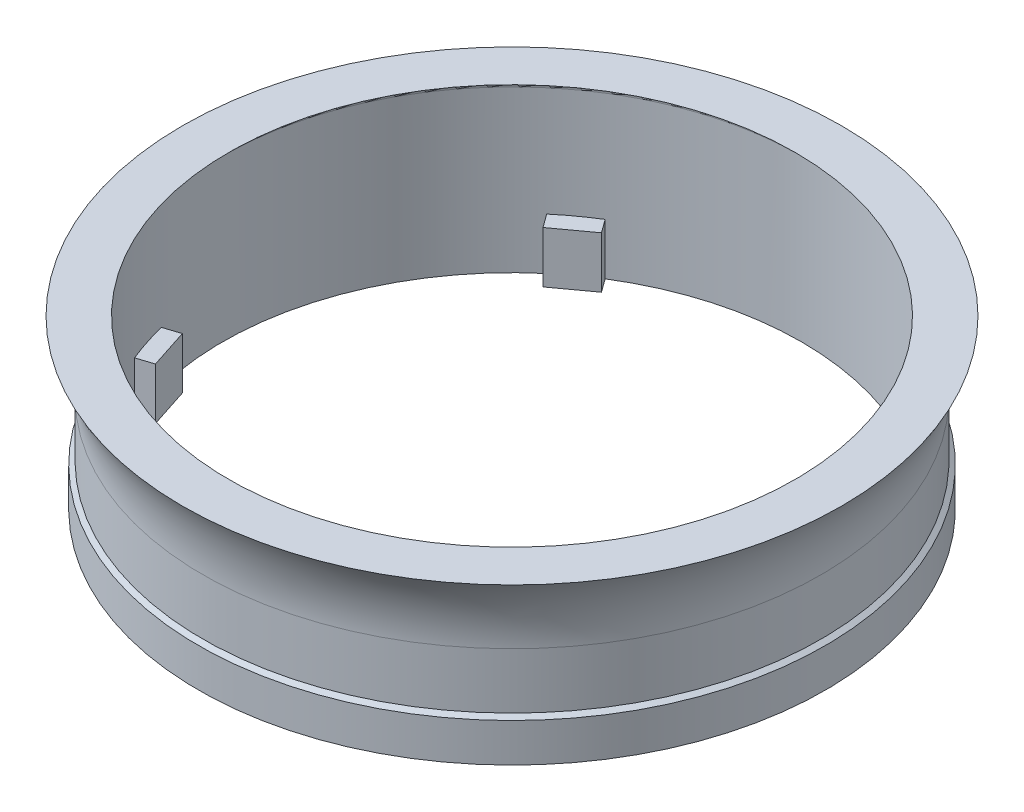
from build123d import *

# Parameters (mm, degrees)
CUT_EXTRUDE3_DEPTH           = 60
CUT_EXTRUDE5_DEPTH           = 2
CUT_EXTRUDE5_DEPTH_BACK      = 30
SKETCH9_R                    = 38
SKETCH9_R_2                  = 23
SKETCH19_W                   = 12
SKETCH19_H                   = 36.5
CUT_REVOLVE2_ANGLE           = 65
CUT_REVOLVE2_OTHER_WAY_ANGLE = 65
SKETCH21_W                   = 3.25
SKETCH21_H                   = 4
BOSS_EXTRUDE3_DEPTH          = 1.35
CIRPATTERN1_COUNT            = 5
CUT_EXTRUDE9_START           = -5
CUT_EXTRUDE9_DEPTH           = 5
SKETCH23_R                   = 10.5
CUT_EXTRUDE10_DEPTH          = 10
SKETCH24_W                   = 15
SKETCH24_H                   = 8
BOSS_EXTRUDE4_DEPTH          = 8
SKETCH26_W                   = 10
SKETCH26_H                   = 6
CUT_EXTRUDE11_DEPTH          = 10
SKETCH27_W                   = 4
SKETCH27_H                   = 5
CUT_EXTRUDE12_DEPTH          = 5
CUT_EXTRUDE14_DEPTH          = 2
CUT_EXTRUDE14_DEPTH_BACK     = 30
SKETCH29_R                   = 1
CUT_EXTRUDE15_DEPTH          = 15
FILLET1_R                    = 6
FILLET2_R                    = 8
INTERSECT2_START             = 13
INTERSECT2_DEPTH             = 50.427876097


# Read off the part's stored shape, not the designer's step: Cut-Extrude9, Intersect2
with BuildPart() as part:
    # Sketch1 → Revolve1 (revolve)
    with BuildSketch(Plane.XY, mode=Mode.PRIVATE) as revolve1_sk:
        with BuildLine():
            Line((0, 63.427876097), (32, 63.427876097))
            ThreePointArc((32, 63.427876097), (37.656854249, 61.084730346), (40, 55.427876097))
            Line((40, 55.427876097), (40, 28.846818009))
            ThreePointArc((40, 28.846818009), (38.792081772, 24.082439968), (35.460140376, 20.469057744))
            Line((35.460140376, 20.469057744), (28.539859624, 15.958818353))
            ThreePointArc((28.539859624, 15.958818353), (25.207918228, 12.345436129), (24, 7.581058088))
            Line((24, 7.581058088), (24, 3.25))
            Line((24, 3.25), (24.35, 3))
            Line((24.35, 3), (24.35, 0))
            Line((24.35, 0), (22.5, 0))
            Line((22.5, 0), (22.5, 12.5))
            ThreePointArc((22.5, 12.5), (22.353553391, 12.853553391), (22, 13))
            Line((22, 13), (0, 13))
            Line((0, 13), (0, 63.427876097))
        make_face()
    revolve(revolve1_sk.sketch.rotate(Axis((0, 0, 0), (0, 1, 0)), 90), axis=Axis((0, 0, 0), (0, 1, 0)))

    # Sketch11 → Cut-Extrude3 (cut)
    with BuildSketch(Plane(origin=(0, 13, 0), x_dir=(-1, 0, 0), z_dir=(0, -1, 0))):
        with BuildLine():
            Line((-21, 0), (21, 0))
            ThreePointArc((21, 0), (0, 21), (-21, 0))
        make_face()
    extrude(amount=-CUT_EXTRUDE3_DEPTH, mode=Mode.SUBTRACT)

    # Sketch9 → Cut-Extrude5 (cut, two sides: drawn at the far end of the back side and taken through both)
    with BuildSketch(Plane(origin=(0, 55.427876097, 0), x_dir=(1, 0, 0), z_dir=(0, 1, 0)).offset(-CUT_EXTRUDE5_DEPTH_BACK)):
        with Locations(Location((0, 0, 0), (0, 0, 270))):
            Circle(SKETCH9_R)
        with Locations(Location((0, 0, 0), (0, 0, 270))):
            Circle(SKETCH9_R_2, mode=Mode.SUBTRACT)
    extrude(amount=CUT_EXTRUDE5_DEPTH + CUT_EXTRUDE5_DEPTH_BACK, mode=Mode.SUBTRACT)

    # Sketch19 → Cut-Revolve2 (revolve, cut)
    with BuildSketch(Plane(origin=(0, 0, 0), x_dir=(0, 0, -1), z_dir=(1, 0, 0))):
        with Locations((-41.064715832, 37.177876097)):
            Rectangle(SKETCH19_W, SKETCH19_H)
    revolve(axis=Axis((0, 0, 0), (0, 1, 0)), revolution_arc=CUT_REVOLVE2_ANGLE, mode=Mode.SUBTRACT)

    # Sketch19 → Cut-Revolve2 other way (revolve, cut)
    with BuildSketch(Plane(origin=(0, 0, 0), x_dir=(0, 0, -1), z_dir=(1, 0, 0))):
        with Locations((-41.064715832, 37.177876097)):
            Rectangle(SKETCH19_W, SKETCH19_H)
    revolve(axis=Axis((0, 0, 0), (0, -1, 0)), revolution_arc=CUT_REVOLVE2_OTHER_WAY_ANGLE, mode=Mode.SUBTRACT)

    # Sketch21 → Boss-Extrude3 (add)
    with BuildSketch(Plane(origin=(0, 0, 22.5), x_dir=(-1, 0, 0), z_dir=(0, 0, -1))):
        with Locations((0, 2)):
            Rectangle(SKETCH21_W, SKETCH21_H)
    boss_extrude3 = extrude(amount=BOSS_EXTRUDE3_DEPTH)

    # CirPattern1: Boss-Extrude3 ×5 about axis
    cirpattern1_axis = Axis((0, 0, 0), (0, 1, 0))
    for i in range(1, CIRPATTERN1_COUNT):
        add(boss_extrude3.rotate(cirpattern1_axis, i * 360 / CIRPATTERN1_COUNT))

    # Cut-Extrude9 outline → Cut-Extrude9 (cut)
    with BuildSketch(Plane(origin=(0, 63.427876097, 0), x_dir=(1, 0, 0), z_dir=(0, 1, 0)).offset(CUT_EXTRUDE9_START)):
        with BuildLine():
            ThreePointArc((40, 0), (0, 40), (-40, 0))
            Line((-40, 0), (-21, 0))
            ThreePointArc((-21, 0), (0, 21), (21, 0))
            Line((21, 0), (40, 0))
        make_face()
    extrude(amount=CUT_EXTRUDE9_DEPTH, mode=Mode.SUBTRACT)

    # Sketch23 → Cut-Extrude10 (cut)
    with BuildSketch(Plane(origin=(0, 0, -40), x_dir=(-1, 0, 0), z_dir=(0, 0, -1))):
        with Locations((0, 42.137876097)):
            Circle(SKETCH23_R)
    extrude(amount=-CUT_EXTRUDE10_DEPTH, mode=Mode.SUBTRACT)

    # Sketch24 → Boss-Extrude4 (add)
    with BuildSketch(Plane(origin=(0, 58.427876097, 0), x_dir=(1, 0, 0), z_dir=(0, 1, 0))):
        with Locations((0, 30)):
            Rectangle(SKETCH24_W, SKETCH24_H)
    extrude(amount=-BOSS_EXTRUDE4_DEPTH)

    # Sketch26 → Cut-Extrude11 (cut)
    with BuildSketch(Plane(origin=(0, 58.427876097, 0), x_dir=(1, 0, 0), z_dir=(0, 1, 0))):
        with Locations((0, 30)):
            Rectangle(SKETCH26_W, SKETCH26_H)
    extrude(amount=-CUT_EXTRUDE11_DEPTH, mode=Mode.SUBTRACT)

    # Sketch27 → Cut-Extrude12 (cut)
    with BuildSketch(Plane(origin=(7.5, 0, 0), x_dir=(0, 0, -1), z_dir=(1, 0, 0))):
        with Locations((30, 53.927876097)):
            Rectangle(SKETCH27_W, SKETCH27_H)
    extrude(amount=-CUT_EXTRUDE12_DEPTH, mode=Mode.SUBTRACT)

    # Sketch28 → Cut-Extrude14 (cut, two sides: drawn at the far end of the back side and taken through both)
    with BuildSketch(Plane(origin=(0, 55.427876097, 0), x_dir=(1, 0, 0), z_dir=(0, 1, 0)).offset(-CUT_EXTRUDE14_DEPTH_BACK)):
        with BuildLine():
            Line((-22.912878475, -2), (22.912878475, -2))
            ThreePointArc((22.912878475, -2), (0, -23), (-22.912878475, -2))
        make_face()
    extrude(amount=CUT_EXTRUDE14_DEPTH + CUT_EXTRUDE14_DEPTH_BACK, mode=Mode.SUBTRACT)

    # Sketch29 → Cut-Extrude15 (cut)
    with BuildSketch(Plane(origin=(0, 0, 0), x_dir=(-1, 0, 0), z_dir=(0, 0, -1))):
        with Locations((-30.416198487, 60.927876097)):
            Circle(SKETCH29_R)
        with Locations((30.416198487, 60.927876097)):
            Circle(SKETCH29_R)
        with Locations((0, 60.927876097)):
            Circle(SKETCH29_R)
    extrude(amount=-CUT_EXTRUDE15_DEPTH, mode=Mode.SUBTRACT)

    # Fillet1
    fillet1_edges = [part.edges().sort_by_distance(p)[0] for p in [
        (21, 35.713938048, 0),
        (-21, 35.713938048, 0),
    ]]
    fillet(fillet1_edges, radius=FILLET1_R)

    # Fillet2
    fillet2_edges = [part.edges().sort_by_distance(p)[0] for p in [
        (-22.912878475, 41.427876097, 2),
        (22.912878475, 41.427876097, 2),
    ]]
    fillet(fillet2_edges, radius=FILLET2_R)

    # Intersect2 outline → Intersect2 (cut)
    with BuildSketch(Plane(origin=(0, 0, 0), x_dir=(1, 0, 0), z_dir=(0, 1, 0)).offset(INTERSECT2_START)):
        with BuildLine():
            Line((-37.080992435, -15), (-42, -15))
            Line((-42, -15), (-42, -42))
            Line((-42, -42), (42, -42))
            Line((42, -42), (42, -15))
            Line((42, -15), (37.080992435, -15))
            ThreePointArc((37.080992435, -15), (0, 40), (-37.080992435, -15))
        make_face()
        with BuildLine():
            ThreePointArc((-13.747727085, 0), (-18.767687244, 2.713664655), (-19.246817919, 8.4))
            ThreePointArc((-19.246817919, 8.4), (0, 21), (19.246817919, 8.4))
            ThreePointArc((19.246817919, 8.4), (18.767687244, 2.713664655), (13.747727085, 0))
            Line((13.747727085, 0), (-13.747727085, 0))
        make_face(mode=Mode.SUBTRACT)
    extrude(amount=INTERSECT2_DEPTH, mode=Mode.SUBTRACT)


solid = part.part
